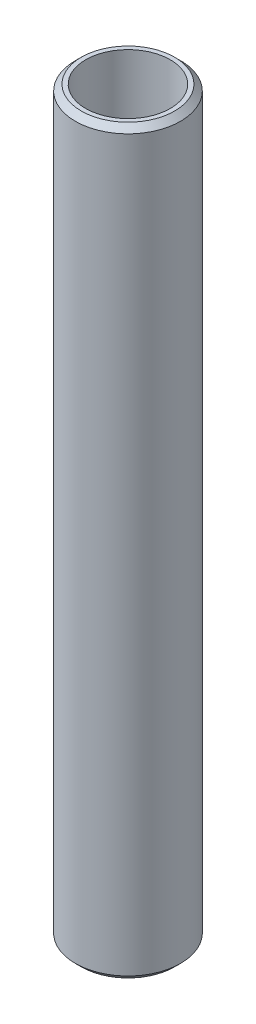
from build123d import *

# Parameters (mm, degrees)
SKETCH1_R           = 40
BOSS_EXTRUDE1_DEPTH = 563.732478379
SKETCH2_R           = 32.163372327
CUT_EXTRUDE1_DEPTH  = 567.563595
CHAMFER1_SIZE       = 4.496045381


with BuildPart() as part:
    # Sketch1 → Boss-Extrude1 (new body)
    with BuildSketch(Plane(origin=(0, 0, 0), x_dir=(1, 0, 0), z_dir=(0, 1, 0))):
        Circle(SKETCH1_R)
    extrude(amount=BOSS_EXTRUDE1_DEPTH)

    # Sketch2 → Cut-Extrude1 (cut, through all)
    with BuildSketch(Plane(origin=(0, 0, 0), x_dir=(1, 0, 0), z_dir=(0, 1, 0))):
        Circle(SKETCH2_R)
    extrude(amount=CUT_EXTRUDE1_DEPTH, mode=Mode.SUBTRACT)

    # Chamfer1
    chamfer1_edges = [part.edges().sort_by_distance(p)[0] for p in [
        (-40, 563.732478379, 0),
        (-40, 0, 0),
    ]]
    chamfer(chamfer1_edges, length=CHAMFER1_SIZE)


solid = part.part
